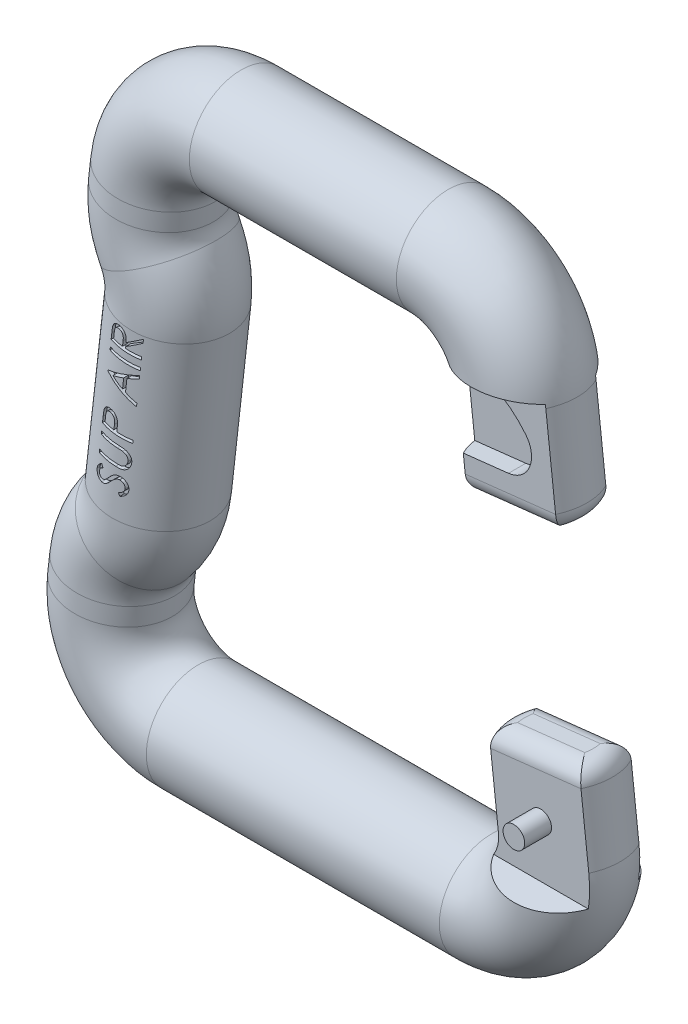
from build123d import *

# Parameters (mm, degrees)
SKETCH2_R           = 5.999999999999999
CUT_EXTRUDE1_DEPTH  = 50.23731898282209
CUT_EXTRUDE3_DEPTH  = 2
FILLET1_R           = 2
FILLET2_R           = 2
CUT_EXTRUDE4_DEPTH  = 2
SKETCH4_R           = 1.2500000000000013
BOSS_EXTRUDE1_DEPTH = 6


with BuildPart() as part:
    # Sweep1: sweep along a path in Sketch1
    with BuildLine(Plane.XY) as sweep1_path:
        Line((24.74193548387098, -11.000000000000007), (25.86987100796293, -20.99028607052877))
        ThreePointArc((25.86987100796293, -20.99028607052877), (23.63815178243092, -27.99635616999022), (16.926690489789717, -31))
        Line((16.926690489789717, -31), (-16.926690489789703, -31.000000000000007))
        ThreePointArc((-16.926690489789703, -31.000000000000007), (-23.638151782430896, -27.996356169990243), (-25.869871007962928, -20.990286070528818))
        Line((-25.869871007962928, -20.990286070528818), (-25.623052047425528, -18.804175277197604))
        ThreePointArc((-25.623052047425528, -18.804175277197604), (-24.95083568241742, -16.265487879724628), (-23.574381586121483, -14.028931896910187))
        ThreePointArc((-23.574381586121483, -14.028931896910187), (-22.197927489825645, -11.792375914095743), (-21.525711124817438, -9.253688516622807))
        Line((-21.525711124817438, -9.253688516622807), (-19.28190239265934, 10.620045968206439))
        ThreePointArc((-19.28190239265934, 10.620045968206439), (-19.371160148682797, 13.244706250312062), (-20.21429210407966, 15.731860658317679))
        ThreePointArc((-20.21429210407966, 15.731860658317679), (-21.057424059476503, 18.219015066323312), (-21.146681815499974, 20.843675348428935))
        Line((-21.146681815499974, 20.843675348428935), (-20.90212907247907, 23.00971392947115))
        ThreePointArc((-20.90212907247907, 23.00971392947115), (-17.955304724296138, 28.711461292641133), (-11.958948554305916, 30.999999999999996))
        Line((-11.958948554305916, 30.999999999999996), (11.95894855430585, 30.999999999999996))
        ThreePointArc((11.95894855430585, 30.999999999999996), (17.955304724296127, 28.711461292641133), (20.90212907247907, 23.009713929471104))
        Line((20.90212907247907, 23.009713929471104), (22.258064516129046, 10.999999999999993))
    # Sketch2 → Sweep1 (sweep)
    with BuildSketch(Plane(origin=(24.74193548387098, -11.000000000000007, 0), x_dir=(0.9936867242414619, 0.11219043660790769, 0), z_dir=(-0.11219043660790769, 0.9936867242414619, 0))):
        Circle(SKETCH2_R)
    sweep(path=sweep1_path.line)

    # Sketch3 → Cut-Extrude1 (cut, through all)
    with BuildSketch(Plane(origin=(0, 0, 0), x_dir=(0, 0, -1), z_dir=(1, 0, 0))):
        Polygon((-5.999999999999998, 24.54661364019623), (-2.900000000000003, 24), (-2.899999999999997, -24), (-5.999999999999998, -24.54661364019623), align=None)
    cut_extrude1 = extrude(amount=CUT_EXTRUDE1_DEPTH, mode=Mode.SUBTRACT)

    # Mirror1: Cut-Extrude1 across plane
    add(cut_extrude1.mirror(Plane.XY), mode=Mode.SUBTRACT)

    # Sketch5 → Cut-Extrude3 (cut)
    with BuildSketch(Plane.XY.offset(2.9)):
        with BuildLine():
            Line((15.127997133283031, 24), (13.078337913522242, 24))
            Line((13.078337913522242, 24), (13.078337913522244, 13.98899280030121))
            Line((13.078337913522244, 13.98899280030121), (21.80930276969724, 14.97474689696582))
            ThreePointArc((21.80930276969724, 14.97474689696582), (24.24615374409276, 16.81207247049478), (23.812818367255925, 19.83303728090512))
            ThreePointArc((23.812818367255925, 19.83303728090512), (19.94436760720821, 22.90435004358217), (15.127997133283031, 24))
        make_face()
    cut_extrude3 = extrude(amount=-CUT_EXTRUDE3_DEPTH, mode=Mode.SUBTRACT)

    # Mirror2: Cut-Extrude3 across plane
    add(cut_extrude3.mirror(Plane.XY), mode=Mode.SUBTRACT)

    # Fillet1
    # the kernel refuses this fillet: 2 mm, written as the material it takes off along each edge
    with BuildSketch(Plane(origin=(22.258064516129036, 10.999999999999991, 0), x_dir=(0.22931075793279015, 0.02588992428273506, 0.9730088838838644), z_dir=(-0.9668660104843982, -0.10916229150630274, 0.2307676577925868))) as fillet1_piece_1:
        with BuildLine():
            CenterArc((6.000000000000002 - FILLET1_R, FILLET1_R), FILLET1_R, 270, 90)
            Line((6.000000000000002 - FILLET1_R, -1.74e-15), (6.000000000000002, -1.75e-15))
            Line((6.000000000000002, -1.75e-15), (6.000000000000003, FILLET1_R))
        make_face()
    revolve(axis=Axis((22.258064516129036, 10.999999999999991, 0), (-0.11219043660790684, 0.993686724241462, 0)), revolution_arc=153.31545765580788, mode=Mode.SUBTRACT)
    with BuildSketch(Plane(origin=(32.445955303624004, 12.150245734072005, 2.9000000000000017), x_dir=(-0.11219043660790687, 0.993686724241462, 0), z_dir=(-0.993686724241462, -0.11219043660790687, 0))) as fillet1_piece_2:
        with BuildLine():
            CenterArc((FILLET1_R, FILLET1_R), FILLET1_R, 180, 90)
            Line((0, FILLET1_R), (0, 0))
            Line((0, 0), (FILLET1_R, 0))
        make_face()
    extrude(amount=20.50523678933512, mode=Mode.SUBTRACT)
    with BuildSketch(Plane(origin=(22.258064516129036, 10.999999999999991, 0), x_dir=(-0.22931075793279074, -0.02588992428273506, -0.9730088838838643), z_dir=(0.9668660104843981, 0.10916229150630273, -0.23076765779258737))) as fillet1_piece_3:
        with BuildLine():
            CenterArc((6.000000000000002 - FILLET1_R, FILLET1_R), FILLET1_R, 270, 90)
            Line((6.000000000000002 - FILLET1_R, 1.89e-15), (6.000000000000002, 7.04e-15))
            Line((6.000000000000002, 7.04e-15), (6.000000000000001, FILLET1_R))
        make_face()
    revolve(axis=Axis((22.258064516129036, 10.999999999999991, 0), (-0.11219043660790684, 0.993686724241462, 0)), revolution_arc=153.31545765580788, mode=Mode.SUBTRACT)
    with BuildSketch(Plane(origin=(32.445955303624004, 12.150245734072005, -2.9000000000000017), x_dir=(-0.11219043660790687, 0.993686724241462, 0), z_dir=(-0.993686724241462, -0.11219043660790687, 0))) as fillet1_piece_4:
        with BuildLine():
            CenterArc((FILLET1_R, -FILLET1_R), FILLET1_R, 90, 90)
            Line((0, -FILLET1_R), (0, 0))
            Line((0, 0), (FILLET1_R, 0))
        make_face()
    extrude(amount=20.50523678933512, mode=Mode.SUBTRACT)

    # Fillet2
    fillet2_edges = [part.edges().sort_by_distance(p)[0] for p in [
        (30.70405582931975, -10.326857380352564, -2.22e-15),
        (24.74193548387098, -11.000000000000007, 2.8999999999999986),
        (18.779815138422208, -11.67314261964745, 0),
        (24.74193548387098, -11.000000000000007, -2.8999999999999986),
    ]]
    fillet(fillet2_edges, radius=FILLET2_R)

    # Sketch6 → Cut-Extrude4 (cut)
    # profile 1 of 6: a face of its own
    with BuildSketch(Plane.XY.offset(5.4)):
        with BuildLine():
            Line((-21.22526216538908, 8.299780960520144), (-21.148138767953185, 8.986880319494503))
            add(Edge.make_bspline(
                [(-21.148138767953185, 8.986880319494503), (-21.142839437375905, 9.032695634793358), (-21.132667241244796, 9.120639265829892), (-21.116866332200168, 9.246694890789366), (-21.099936640113985, 9.360949642628626), (-21.083152302744764, 9.46356599890711), (-21.06658311138429, 9.55455887813084), (-21.049715244450358, 9.633794267895349), (-21.03367222711162, 9.701470363421503), (-21.020312918258497, 9.741825900689525), (-21.01422450513267, 9.760217659238092)],
                knots=[0, 0, 0, 0, 1.4082753462719975, 2.703219363274542, 3.878946779330745, 4.9348021713206265, 5.878173646674772, 6.7025414307882905, 7.4086921808716, 8, 8, 8, 8], degree=3))
            add(Edge.make_bspline(
                [(-21.01422450513267, 9.760217659238092), (-21.004997336875274, 9.78467011580734), (-20.986799069457152, 9.832896433054856), (-20.953651628540246, 9.901913180221472), (-20.91575468037188, 9.966706009392654), (-20.87280767946197, 10.027030755593605), (-20.825711439156933, 10.083318461106037), (-20.774310934955984, 10.13558869252851), (-20.717965331991152, 10.18340543694039), (-20.65709998156238, 10.226598140005887), (-20.592859752786538, 10.265255399302289), (-20.525577138081772, 10.297683995089784), (-20.45519029562011, 10.322874256641192), (-20.382622966184375, 10.34284386881235), (-20.306907665920075, 10.354969362746209), (-20.22914636645212, 10.362383206652405), (-20.148417303044397, 10.362230263848703), (-20.09409206083215, 10.357293705592717), (-20.066307838466003, 10.354768941289375)],
                knots=[0, 0, 0, 0, 1.0322887001872207, 2.0359296909605744, 3.021004968115988, 3.994630807669797, 4.958220814565339, 5.9180869595093855, 6.887631780398401, 7.874134296207386, 8.863915958183112, 9.846911552630642, 10.819661198846822, 11.81421271346405, 12.816153048960262, 13.845298051303622, 14.89799445639931, 16, 16, 16, 16], degree=3))
            add(Edge.make_bspline(
                [(-20.066307838466003, 10.354768941289375), (-20.020983808090005, 10.347932558280364), (-19.932350818060243, 10.33456373247095), (-19.80551719681369, 10.296128438715908), (-19.69016500336988, 10.239582174356288), (-19.584830643560792, 10.169485396780466), (-19.492222646829394, 10.084698849996515), (-19.413610241287586, 9.98609266095731), (-19.350533047690494, 9.87459696563993), (-19.310781412434384, 9.77199247210461), (-19.287039698755756, 9.683152169005224), (-19.271981318753568, 9.610422435391367), (-19.263028934081817, 9.531796921707242), (-19.255313924655034, 9.448139753160692), (-19.25399203705758, 9.35846988614241), (-19.25514646541146, 9.263523832116041), (-19.260826321061533, 9.162937280395028), (-19.267700461210275, 9.094362693145571), (-19.27123572308139, 9.059095864366297)],
                knots=[0, 0, 0, 0, 1.2721769432025023, 2.4877939006647645, 3.6636569702811053, 4.8285560842238775, 5.990992636275886, 7.136613279875263, 8.317019071318532, 9.53580388968788, 10.181451710189275, 10.870207033566075, 11.596486492895929, 12.378182037436407, 13.202848799946214, 14.085805689609556, 15.015560053621257, 15.999999999999998, 15.999999999999998, 15.999999999999998, 15.999999999999998], degree=3))
            Line((-19.27123572308139, 9.059095864366297), (-17.528948062824977, 10.119893140007322))
            Line((-17.528948062824977, 10.119893140007322), (-17.576624344876258, 9.692909966930399))
            Line((-17.576624344876258, 9.692909966930399), (-19.31891200513267, 8.634917178468863))
            Line((-19.31891200513267, 8.634917178468863), (-19.341347902568568, 8.437901954109888))
            Line((-19.341347902568568, 8.437901954109888), (-17.737882357696773, 8.25841477462271))
            Line((-17.737882357696773, 8.25841477462271), (-17.77644405641472, 7.913462851545785))
            Line((-17.77644405641472, 7.913462851545785), (-21.22526216538908, 8.299780960520144))
        make_face()
        with BuildLine():
            Line((-20.848759761542926, 8.60687230667399), (-19.676484120517284, 8.475762531032963))
            Line((-19.676484120517284, 8.475762531032963), (-19.605670819235232, 9.06821044769963))
            add(Edge.make_bspline(
                [(-19.605670819235232, 9.06821044769963), (-19.602708810591565, 9.09600600417584), (-19.59699073098247, 9.149664593272018), (-19.591250126351465, 9.227763551134046), (-19.588739415280845, 9.300488466327279), (-19.587318346326057, 9.367856077205186), (-19.59058671306946, 9.42982825812198), (-19.59505225722329, 9.486504276218675), (-19.602590189362406, 9.53786232948604), (-19.61664447626103, 9.59832303561509), (-19.64017250546451, 9.667671807439158), (-19.680912037187436, 9.742861502760794), (-19.731664125007356, 9.810613353123522), (-19.793900798750318, 9.868230516557748), (-19.862969706864675, 9.917575702085912), (-19.93889385296121, 9.955660542075968), (-20.020353921951955, 9.983082189703985), (-20.07733636423299, 9.991513302724561), (-20.106271780773696, 9.995794582315016)],
                knots=[0, 0, 0, 0, 1.116804667455485, 2.155961971942709, 3.1277859603184335, 4.024240112258224, 4.846793603243793, 5.605954830140939, 6.295291751765251, 6.918184528589704, 8.084631972486369, 9.208441058437982, 10.32149201286966, 11.451027748790125, 12.583184936360725, 13.702329280963324, 14.833253601156654, 16, 16, 16, 16], degree=3))
            add(Edge.make_bspline(
                [(-20.106271780773696, 9.995794582315016), (-20.134780038695308, 9.99781327016558), (-20.19098082450644, 10.001792883505024), (-20.27500034033198, 9.99293145023248), (-20.35600944588299, 9.971771597652452), (-20.433176485813554, 9.93870048626049), (-20.50398899996697, 9.895468568787589), (-20.567777387154837, 9.844200855764223), (-20.620560562113507, 9.782558611085065), (-20.65798447205481, 9.724999175753446), (-20.683389801338866, 9.6724714682596), (-20.700297021898265, 9.625986540770887), (-20.717578669471667, 9.573592774722783), (-20.731467251563007, 9.514001622276536), (-20.74687078472378, 9.448595477644771), (-20.75871047263346, 9.376098869723588), (-20.771099631210436, 9.297427890250864), (-20.777447521304467, 9.242584265993425), (-20.780750947440364, 9.214043781032965)],
                knots=[0, 0, 0, 0, 1.1632796948630364, 2.2932735191746967, 3.4255542548063835, 4.565185983436548, 5.702385963412157, 6.79903542384222, 7.8861668733804855, 8.996102559097864, 9.588392885088506, 10.26077810904959, 11.011001767887944, 11.835906216229654, 12.753527901846914, 13.749688968881866, 14.828943764939497, 15.999999999999998, 15.999999999999998, 15.999999999999998, 15.999999999999998], degree=3))
            Line((-20.780750947440364, 9.214043781032965), (-20.848759761542926, 8.60687230667399))
        make_face(mode=Mode.SUBTRACT)
    # profile 2 of 6: a face of its own
    with BuildSketch(Plane.XY.offset(5.4)):
        Polygon((-21.353794975325798, 7.16164798184985), (-21.315233276607852, 7.506599904926773), (-17.86641516763349, 7.1202817959524145), (-17.904976866351436, 6.77532987287549), align=None)
    # profile 3 of 6: a face of its own
    with BuildSketch(Plane.XY.offset(5.4)):
        Polygon((-21.593168497764445, 5.052900766624087), (-17.963460965713164, 6.274956055085625), (-18.005528273405467, 5.904763747393318), (-19.200239811867007, 5.489699644829215), (-19.367106799046493, 4.0033214397010095), (-18.292988209302905, 3.3372557345728047), (-18.336457760584956, 2.9530409909830615), (-21.602283081097777, 4.968766151239472), align=None)
        Polygon((-20.865404074687522, 4.92880220893178), (-19.6826116067388, 4.196129933290753), (-19.550800709302905, 5.375416792265112), align=None, mode=Mode.SUBTRACT)
    # profile 4 of 6: a face of its own
    with BuildSketch(Plane.XY.offset(5.4)):
        with BuildLine():
            Line((-22.224134409867027, -0.5497770510097729), (-22.147011012431125, 0.13732230796458617))
            add(Edge.make_bspline(
                [(-22.147011012431125, 0.13732230796458617), (-22.141508700880745, 0.18454410591075635), (-22.13096040618169, 0.275071411824813), (-22.11416374801412, 0.4045599034531211), (-22.09751054342439, 0.52195472252342), (-22.080338383490083, 0.6269910113556525), (-22.06170884201567, 0.7196364267623955), (-22.044629289905423, 0.8004832208956563), (-22.027102555771865, 0.869299884190706), (-22.012651644521544, 0.9102721139929228), (-22.006085531661896, 0.9288888143748424)],
                knots=[0, 0, 0, 0, 1.4165767783512053, 2.715671256539882, 3.8905700806194283, 4.949545173868573, 5.886425593501877, 6.705964850652123, 7.412024564555704, 8, 8, 8, 8], degree=3))
            add(Edge.make_bspline(
                [(-22.006085531661896, 0.9288888143748424), (-21.996833017006566, 0.9521675796508015), (-21.97850576904686, 0.9982778231144697), (-21.945409328774698, 1.064516808970198), (-21.90745871090974, 1.1265802662340811), (-21.86612706788889, 1.1854119012790822), (-21.819654405085757, 1.2396615893176666), (-21.768107198753324, 1.2891282005011917), (-21.713219552560766, 1.3360279326451998), (-21.65383597164073, 1.3783522549382043), (-21.591094432669045, 1.4168054582685161), (-21.523882532040705, 1.447132425638073), (-21.454538567158814, 1.4730162069466741), (-21.381731076346327, 1.4907511602600858), (-21.306555483007866, 1.5036137631681623), (-21.228199198085704, 1.5099966299273366), (-21.146832986655106, 1.509006459484795), (-21.091799189951956, 1.5041685969806826), (-21.063777839354202, 1.5017053207850988)],
                knots=[0, 0, 0, 0, 1.0051594586673875, 1.9910053995358428, 2.9675244703069343, 3.9227712245342, 4.874094977569468, 5.8293417317967675, 6.787807136433937, 7.769224900013368, 8.753775760606036, 9.73586574355943, 10.724029646975051, 11.720528892482337, 12.73834604283004, 13.782999043351941, 14.871177988738769, 16, 16, 16, 16], degree=3))
            add(Edge.make_bspline(
                [(-21.063777839354202, 1.5017053207850988), (-21.03566044804812, 1.4979185824190397), (-20.98072561981454, 1.4905201783693742), (-20.900914741140184, 1.4725118183316366), (-20.8251952971937, 1.4505866826024034), (-20.75404822829092, 1.422457935990305), (-20.68763806159095, 1.3885957065515409), (-20.62583954658505, 1.349142962945414), (-20.56813655531266, 1.3048041962459183), (-20.51458775728983, 1.2557782556950186), (-20.46654430641544, 1.201583098561871), (-20.422516185610093, 1.1440863668955454), (-20.384869151611614, 1.081979624720846), (-20.35177914312775, 1.0165963533265758), (-20.32354782743739, 0.947451459181757), (-20.300571445040802, 0.8742613845765115), (-20.281987439065432, 0.7972393245028695), (-20.27457150698013, 0.7441065484755667), (-20.270809089354202, 0.7171500323235607)],
                knots=[0, 0, 0, 0, 1.1203220365173474, 2.18884810373767, 3.2288318675058454, 4.231805184716641, 5.206284375570954, 6.169324588133576, 7.124052803457623, 8.078021791452562, 9.032616069361207, 9.981747546100836, 10.935001414813907, 11.897067472698165, 12.874341876725532, 13.881725007413635, 14.92530904045551, 16, 16, 16, 16], degree=3))
            add(Edge.make_bspline(
                [(-20.270809089354202, 0.7171500323235607), (-20.268713549059083, 0.6949627165371062), (-20.264154620975052, 0.6466933621926676), (-20.261949260792754, 0.5675921798338753), (-20.26184533596646, 0.4761702302358449), (-20.265688579900846, 0.37189561065398086), (-20.272712215890174, 0.2552465307039557), (-20.28359885376443, 0.1260357382040543), (-20.29685226109272, -0.01560532447783474), (-20.30738347899166, -0.11415851120729845), (-20.312876397046512, -0.16556230742002928)],
                knots=[0, 0, 0, 0, 0.6041145931229165, 1.3142744097913275, 2.1443785323552222, 3.082741129999513, 4.142860979208862, 5.312676663059557, 6.598334302989068, 8, 8, 8, 8], degree=3))
            Line((-20.312876397046512, -0.16556230742002928), (-20.340220147046512, -0.41165605742002925))
            Line((-20.340220147046512, -0.41165605742002925), (-18.736754602174717, -0.5911432369072088))
            Line((-18.736754602174717, -0.5911432369072088), (-18.775316300892666, -0.936095159984132))
            Line((-18.775316300892666, -0.936095159984132), (-22.224134409867027, -0.5497770510097729))
        make_face()
        with BuildLine():
            Line((-21.850436493200355, -0.24198458306105494), (-20.678160852174717, -0.37379548049695244))
            Line((-20.678160852174717, -0.37379548049695244), (-20.60594530730292, 0.20883673104150924))
            add(Edge.make_bspline(
                [(-20.60594530730292, 0.20883673104150924), (-20.603067534883458, 0.23734040962931302), (-20.597505284059014, 0.29243323373601704), (-20.590641958617045, 0.3723298125592024), (-20.588271816876482, 0.44673242488093257), (-20.587182650554887, 0.5152350311998969), (-20.58915484815389, 0.578195110646081), (-20.59420624479361, 0.6352406502468766), (-20.60055857256781, 0.6869590154155945), (-20.614806766370336, 0.747163707528242), (-20.63866623536354, 0.8159591829592266), (-20.678198625729983, 0.891443058768465), (-20.729428620620926, 0.9588969816499734), (-20.79107116437421, 1.0173715064721023), (-20.86067037715491, 1.0664307957261119), (-20.936151011232294, 1.1055769647338747), (-21.017852990086016, 1.1327685731389898), (-21.07481615438827, 1.1412358205341058), (-21.103741781661896, 1.1455354489902274)],
                knots=[0, 0, 0, 0, 1.1369878110965272, 2.1976065052533205, 3.1814365416748482, 4.090415647221283, 4.916342924350731, 5.679643787580509, 6.363028306959409, 6.981735579918175, 8.131588121449868, 9.243483230792846, 10.349055082486776, 11.477384921729541, 12.60193462296951, 13.717768390284233, 14.841093508351483, 16, 16, 16, 16], degree=3))
            add(Edge.make_bspline(
                [(-21.103741781661896, 1.1455354489902274), (-21.132255586084355, 1.1475773560330378), (-21.18846730619062, 1.151602743367289), (-21.272574974674537, 1.1423868535134991), (-21.354465885919932, 1.1223256476374288), (-21.43268269174648, 1.089086137651306), (-21.504807396282473, 1.0461170709873175), (-21.569644173542653, 0.9946218330770613), (-21.62268923624022, 0.9325369314120868), (-21.660654341172794, 0.8746483771883674), (-21.685595166648447, 0.8216601857283193), (-21.70258283029876, 0.7752342509420415), (-21.72003037764546, 0.7231289554166562), (-21.734000494060734, 0.6640565008958506), (-21.74804278492816, 0.5988492122574686), (-21.761655655606152, 0.5274180496606043), (-21.77237563620919, 0.4494103865538693), (-21.778993834325007, 0.3953430397659561), (-21.782427679097793, 0.36729025668253495)],
                knots=[0, 0, 0, 0, 1.1623833135475303, 2.2915064054332555, 3.4297823766858833, 4.586068412239483, 5.738704186598868, 6.841885626052547, 7.941611387232348, 9.05069179660089, 9.651115043766858, 10.322982151960717, 11.063566568227671, 11.887835374996813, 12.79341241651033, 13.781128502078108, 14.848740977334153, 16, 16, 16, 16], degree=3))
            Line((-21.782427679097793, 0.36729025668253495), (-21.850436493200355, -0.24198458306105494))
        make_face(mode=Mode.SUBTRACT)
    # profile 5 of 6: a face of its own
    with BuildSketch(Plane.XY.offset(5.4)):
        with BuildLine():
            Line((-22.58015939059863, -3.701538601958534), (-22.541597691880682, -3.3565866788816106))
            Line((-22.541597691880682, -3.3565866788816106), (-20.459265961111452, -3.5900602365739185))
            add(Edge.make_bspline(
                [(-20.459265961111452, -3.5900602365739185), (-20.429831244941976, -3.593450434406288), (-20.374036168036106, -3.599876735502384), (-20.294486141612765, -3.6072034456161157), (-20.22371500238023, -3.614371697565665), (-20.161587912988253, -3.620373081649934), (-20.10799736429661, -3.6233392343411226), (-20.063176570911956, -3.6268430470475335), (-20.026908023712828, -3.6272808312801796), (-20.00563963660654, -3.6272380322191187), (-19.99652557649607, -3.6272196917021238)],
                knots=[0, 0, 0, 0, 1.5309628144647474, 2.9020217990641752, 4.127679995824138, 5.206793532866248, 6.12656749953364, 6.900951253817214, 7.529028868668444, 8, 8, 8, 8], degree=3))
            add(Edge.make_bspline(
                [(-19.99652557649607, -3.6272196917021238), (-19.963273899591645, -3.6258289764417846), (-19.89874859912785, -3.623130275853212), (-19.805859958852302, -3.6074770465565846), (-19.72008675880352, -3.5833755704888612), (-19.641289305523856, -3.548151724398353), (-19.56742505036213, -3.5022386155007346), (-19.50020298961454, -3.441040927295202), (-19.435903757483956, -3.368400709127424), (-19.377738128218894, -3.2838146842603106), (-19.326491578425518, -3.192467834116856), (-19.286245628473058, -3.0972651280776855), (-19.257414909947993, -3.000570746919455), (-19.24766568719079, -2.9349017859792923), (-19.242819647008886, -2.9022597558046876)],
                knots=[0, 0, 0, 0, 1.0403779717065162, 2.0188666398159834, 2.939880111275459, 3.8203839098019503, 4.710940239829494, 5.648494415179196, 6.653453166769341, 7.740671601037499, 8.853551786202107, 9.925043290625831, 10.96860253994111, 12, 12, 12, 12], degree=3))
            add(Edge.make_bspline(
                [(-19.242819647008886, -2.9022597558046876), (-19.2405613636131, -2.8740013798398416), (-19.236045796283143, -2.81749713438386), (-19.24046331010101, -2.73249587348956), (-19.254798059518137, -2.648413288603823), (-19.277838609482284, -2.5659144654577792), (-19.30937779001453, -2.4866762798691013), (-19.347410464968544, -2.4112311807150215), (-19.396263651834552, -2.3433293750207547), (-19.450633871193688, -2.279593444486646), (-19.513601191604483, -2.2227937637649857), (-19.583558808823632, -2.1719507083215017), (-19.66108438089075, -2.1273355190939416), (-19.716965106896552, -2.1037941884890796), (-19.745523973931963, -2.091762960932893)],
                knots=[0, 0, 0, 0, 0.9913586576189385, 1.982278563874224, 2.9692748231959567, 3.9714730917003025, 4.97393834609509, 5.950714156133253, 6.9196503264343345, 7.8937855945808675, 8.878100762231629, 9.879364019486232, 10.916210197560797, 12, 12, 12, 12], degree=3))
            add(Edge.make_bspline(
                [(-19.745523973931963, -2.091762960932893), (-19.75763126121018, -2.0874180329353553), (-19.78436638327614, -2.077823631009254), (-19.829548584779758, -2.065336418859393), (-19.883493260505695, -2.0538525603732443), (-19.945911672149123, -2.041944624587025), (-20.01698050372636, -2.030054834256271), (-20.096936593004674, -2.0182631509288425), (-20.18571064067995, -2.0062057049023205), (-20.247977607740992, -1.9993091560225724), (-20.280479903419142, -1.9957092750354566)],
                knots=[0, 0, 0, 0, 0.566776084729653, 1.2515460698266585, 2.063738505205296, 2.9970038942381603, 4.05192826499323, 5.23910222148392, 6.558858409684378, 8, 8, 8, 8], degree=3))
            Line((-20.280479903419142, -1.9957092750354566), (-22.362811634188375, -1.7622357173431493))
            Line((-22.362811634188375, -1.7622357173431493), (-22.324249935470423, -1.4179849160610978))
            Line((-22.324249935470423, -1.4179849160610978), (-20.241918204701193, -1.6514584737534057))
            add(Edge.make_bspline(
                [(-20.241918204701193, -1.6514584737534057), (-20.204498820925906, -1.655931665249119), (-20.13140399332426, -1.6646695740070987), (-20.024791051362996, -1.6808359135867923), (-19.923795554888123, -1.699075885071107), (-19.828440984046296, -1.7189236867097868), (-19.73954884008289, -1.742453795390077), (-19.65605115430178, -1.7667082451462606), (-19.578624476553703, -1.7939638867180208), (-19.506147770304455, -1.823570948624649), (-19.437864267948015, -1.8566655921938024), (-19.373234502801964, -1.8952069205142335), (-19.311916789477102, -1.940003400476012), (-19.25315069268832, -1.9894877856352602), (-19.197486426248133, -2.044682548575745), (-19.14468210425238, -2.104907658537581), (-19.095979963215886, -2.171435897302611), (-19.048936550649355, -2.2415172287739624), (-19.006707151142926, -2.3158659251591502), (-18.972666891430368, -2.3943861609334802), (-18.943971952348797, -2.474992323618041), (-18.924226961920827, -2.559020378388503), (-18.909551745985777, -2.645397816722291), (-18.904056184785688, -2.7348201783557), (-18.90323640421998, -2.8269605644301605), (-18.90943848183098, -2.888967805180812), (-18.912591281624273, -2.920488922471354)],
                knots=[0, 0, 0, 0, 1.2967658679279042, 2.533095630999796, 3.7098979467260054, 4.828226582658274, 5.883503038414783, 6.873347322964681, 7.819528533368582, 8.706652878199817, 9.566265930858833, 10.428283290082634, 11.29213692355788, 12.176669306779232, 13.069498456437014, 13.987190711434414, 14.929742101056382, 15.90447538235228, 16.89104722907586, 17.866841589234088, 18.846043490372153, 19.83107353573146, 20.83325563670343, 21.85717652870428, 22.91070479585999, 24, 24, 24, 24], degree=3))
            add(Edge.make_bspline(
                [(-18.912591281624273, -2.920488922471354), (-18.917064364159266, -2.954678206022732), (-18.92584344853316, -3.0217797188234963), (-18.94624197176536, -3.1197809419782945), (-18.973070662042616, -3.2128388147560236), (-19.00461343642457, -3.302046980658539), (-19.04217129667902, -3.38692341655517), (-19.086958522664233, -3.4667801910428433), (-19.135606285714054, -3.54320386335539), (-19.19145499454659, -3.6134961070895586), (-19.250396259026132, -3.6794067825191132), (-19.31372617196252, -3.7385679162086234), (-19.380728725224134, -3.7907027470156582), (-19.450951697315308, -3.836275475515198), (-19.52426339558557, -3.8758705825692386), (-19.600887281797917, -3.9089311519460677), (-19.681117351821776, -3.93529715801173), (-19.736509603864455, -3.9467582401632426), (-19.764454262393503, -3.9525402045226365)],
                knots=[0, 0, 0, 0, 1.151508229486181, 2.2600047785423487, 3.339843946014751, 4.384338515858936, 5.418748478736872, 6.435569397388422, 7.440301204627874, 8.441326062389146, 9.43068488572108, 10.391765546968239, 11.331849233806995, 12.262943554749327, 13.18506001402019, 14.11172560437248, 15.047390542014899, 16, 16, 16, 16], degree=3))
            add(Edge.make_bspline(
                [(-19.764454262393503, -3.9525402045226365), (-19.783352966181855, -3.955600099400351), (-19.824485107530656, -3.9622598169149574), (-19.891514748116908, -3.9671445121977795), (-19.96844949619809, -3.9700822448444293), (-20.055238574625392, -3.969160446532946), (-20.151973552689284, -3.9643906713692214), (-20.258616197532525, -3.958476238527412), (-20.375027650162, -3.948484333974569), (-20.45577837676043, -3.939625312965953), (-20.4978276598294, -3.935012159650842)],
                knots=[0, 0, 0, 0, 0.6243066069215494, 1.3587740137351718, 2.1903793562298053, 3.135820171427915, 4.188964092085398, 5.34988354910652, 6.620006264915658, 8, 8, 8, 8], degree=3))
            Line((-20.4978276598294, -3.935012159650842), (-22.58015939059863, -3.701538601958534))
        make_face()
    # profile 6 of 6: a face of its own
    with BuildSketch(Plane.XY.offset(5.4)):
        with BuildLine():
            Line((-20.08678108955881, -6.791509478646178), (-20.229809935712655, -6.478809158133358))
            add(Edge.make_bspline(
                [(-20.229809935712655, -6.478809158133358), (-20.181964608804048, -6.458383439629535), (-20.090125933605282, -6.419176456448977), (-19.964764225278927, -6.349586072788355), (-19.85575598587952, -6.276286929215532), (-19.76555133293599, -6.196443936224608), (-19.690602596263933, -6.112997379199675), (-19.63564534607771, -6.022438633711802), (-19.59555842823656, -5.927541224927696), (-19.585090803019018, -5.860769622286317), (-19.579870031866502, -5.82746701069746)],
                knots=[0, 0, 0, 0, 1.290925625361476, 2.4779201412878296, 3.554723080839919, 4.54551879932194, 5.462610222408984, 6.327470803613783, 7.165819180686342, 8, 8, 8, 8], degree=3))
            add(Edge.make_bspline(
                [(-19.579870031866502, -5.82746701069746), (-19.577407007304444, -5.798732224722194), (-19.57251823924846, -5.741697590989605), (-19.57980704267256, -5.656425261751572), (-19.59568229053267, -5.572780434364254), (-19.622434070762548, -5.492136624017914), (-19.657467893939984, -5.415871342805321), (-19.702322058386688, -5.347325850133576), (-19.75407563071093, -5.286291743582237), (-19.814369544826334, -5.235276926105592), (-19.879123008616332, -5.192593748682079), (-19.947877507100472, -5.15920855692969), (-20.01982906724922, -5.135446940534539), (-20.069567970144377, -5.127982483961609), (-20.0944934293024, -5.1242418504410505)],
                knots=[0, 0, 0, 0, 1.0695709813557621, 2.122952620045213, 3.166666210637488, 4.226396802343181, 5.271156975869077, 6.275305450991947, 7.260280780233762, 8.233013219960455, 9.19859083083084, 10.134358472279239, 11.06507845979757, 12, 12, 12, 12], degree=3))
            add(Edge.make_bspline(
                [(-20.0944934293024, -5.1242418504410505), (-20.123492195078768, -5.12259285472382), (-20.1822157387588, -5.119253579087893), (-20.27141828116516, -5.131945240593908), (-20.361210854463117, -5.159775417600256), (-20.41831668976618, -5.188571669133503), (-20.447858813917783, -5.203468613261563)],
                knots=[0, 0, 0, 0, 0.9460467536096231, 1.915778702009981, 2.921785768164213, 4, 4, 4, 4], degree=3))
            add(Edge.make_bspline(
                [(-20.447858813917783, -5.203468613261563), (-20.46926829366678, -5.215857372914401), (-20.514302507005674, -5.2419167658445955), (-20.58222471750421, -5.287774703513849), (-20.653752619129296, -5.3419347220989835), (-20.72858113727153, -5.404731681638605), (-20.807775580340927, -5.474931691659438), (-20.891332349262427, -5.552678731301434), (-20.978280850838587, -5.639215630570936), (-21.03670685855784, -5.700429099338508), (-21.06694935878958, -5.732114446594896)],
                knots=[0, 0, 0, 0, 0.7264719163358938, 1.5281123898639268, 2.4055191417612494, 3.3610237841103374, 4.396976586613083, 5.514208626024208, 6.7133033876837995, 8, 8, 8, 8], degree=3))
            add(Edge.make_bspline(
                [(-21.06694935878958, -5.732114446594896), (-21.096990713622976, -5.76353522029346), (-21.154327313580353, -5.823504563949788), (-21.23800383421486, -5.9076504807516566), (-21.31415600581656, -5.982731566341084), (-21.383523590233246, -6.0482826478830365), (-21.446718862108913, -6.103892894367981), (-21.50314723014945, -6.149855769859566), (-21.552266400949033, -6.187345969098336), (-21.584002847905346, -6.206981210209221), (-21.5983996793024, -6.2158884850564355)],
                knots=[0, 0, 0, 0, 1.4483144934646788, 2.7642371385970828, 3.953563445864588, 5.011213123113441, 5.943679914383341, 6.757250636168316, 7.436242718521421, 8, 8, 8, 8], degree=3))
            add(Edge.make_bspline(
                [(-21.5983996793024, -6.2158884850564355), (-21.620440496602196, -6.228120645682677), (-21.66379738694038, -6.252182750080047), (-21.731017911243438, -6.282541891791087), (-21.798704432230096, -6.307142676336701), (-21.867251852607, -6.325424168631594), (-21.936176886323253, -6.338084848222507), (-22.005799383252274, -6.345279195067829), (-22.076211359913767, -6.34600722474524), (-22.12309232597069, -6.3420019782687325), (-22.14667692289214, -6.339987042748743)],
                knots=[0, 0, 0, 0, 1.0570478813378734, 2.0793380050296224, 3.0902837036602504, 4.074787628975462, 5.051598276776991, 6.02707976244133, 7.007475048519726, 8, 8, 8, 8], degree=3))
            add(Edge.make_bspline(
                [(-22.14667692289214, -6.339987042748743), (-22.183362819088426, -6.334729772729083), (-22.255519431501796, -6.324389373979345), (-22.35899383475699, -6.290809707231296), (-22.45634580817552, -6.246162619624347), (-22.54638774065274, -6.188253998960974), (-22.627805130160223, -6.119350154350673), (-22.69770164319746, -6.03860646958095), (-22.75803898775962, -5.9493625335541465), (-22.805168967594888, -5.850390056128171), (-22.840109117245213, -5.74554541697587), (-22.86203746668983, -5.636810163934285), (-22.870356287387597, -5.525016950488378), (-22.86422344115255, -5.450241560819616), (-22.861120031866502, -5.412402908133358)],
                knots=[0, 0, 0, 0, 1.0195195273469124, 2.005268591205431, 2.984856399302119, 3.9637666435563137, 4.945827815184059, 5.913275464044463, 6.897382488813531, 7.905448675126987, 8.923645405983335, 9.935243202104756, 10.955169398605177, 11.999999999999998, 11.999999999999998, 11.999999999999998, 11.999999999999998], degree=3))
            add(Edge.make_bspline(
                [(-22.861120031866502, -5.412402908133358), (-22.85520636368332, -5.3724355599302855), (-22.84347455650716, -5.293146494677316), (-22.80662344944876, -5.1789843063690055), (-22.756468117490968, -5.07015990079843), (-22.701879892299978, -4.98474856059005), (-22.649816718114923, -4.918662633287132), (-22.60402852305017, -4.868588951670576), (-22.5509911460166, -4.8193885213008105), (-22.493096173409732, -4.768327711837919), (-22.427468343864234, -4.718937826614977), (-22.355674581546722, -4.66925650864148), (-22.278228952806735, -4.6185129975337995), (-22.223259605075853, -4.586686236538332), (-22.195054326738298, -4.5703556324923325)],
                knots=[0, 0, 0, 0, 1.2970514684495411, 2.5731504125772644, 3.840481864390654, 5.141119206432395, 5.82055133012562, 6.543812626731447, 7.319791446387525, 8.145366721616103, 9.024492068418565, 9.958268770504104, 10.952368911118683, 12, 12, 12, 12], degree=3))
            Line((-22.195054326738298, -4.5703556324923325), (-22.013463781866502, -4.8760447350564355))
            add(Edge.make_bspline(
                [(-22.013463781866502, -4.8760447350564355), (-22.036026678117516, -4.889397346564089), (-22.0795127699376, -4.915132202745672), (-22.140477709449335, -4.955693238359201), (-22.196551485737885, -4.9936535030316564), (-22.2464243017006, -5.031078213943303), (-22.291006970822817, -5.066671796547599), (-22.32942928485279, -5.101768138430686), (-22.362881555654578, -5.135334155739274), (-22.3987790824398, -5.178776145372113), (-22.435478496018124, -5.234521852781042), (-22.469553864648244, -5.305439367789158), (-22.49380657363283, -5.380746514895204), (-22.50168562100596, -5.433051875465038), (-22.505651281866506, -5.459378068389769)],
                knots=[0, 0, 0, 0, 1.1857721267508803, 2.2853713019787083, 3.3117357407766073, 4.248425441987792, 5.105351997793476, 5.891179199578453, 6.601400320824357, 7.247077345093765, 8.437553068758351, 9.610245381049246, 10.797195154457185, 12, 12, 12, 12], degree=3))
            add(Edge.make_bspline(
                [(-22.505651281866506, -5.459378068389769), (-22.508039466772527, -5.492800129619382), (-22.512670010981903, -5.55760345858363), (-22.499310037725124, -5.652448605499283), (-22.467624267455303, -5.738997750791603), (-22.420706343764166, -5.816441901117713), (-22.360025685168747, -5.881382942513271), (-22.288676374287185, -5.931781720655304), (-22.208342534600494, -5.967427648596032), (-22.15028564150186, -5.9768950287130425), (-22.120735416481885, -5.981713805569255)],
                knots=[0, 0, 0, 0, 1.1066019033117374, 2.145633289344594, 3.1413665910926585, 4.137460230597412, 5.122352461010867, 6.060051567470116, 7.012590759704947, 8, 8, 8, 8], degree=3))
            add(Edge.make_bspline(
                [(-22.120735416481885, -5.981713805569255), (-22.102051415260803, -5.983339490956945), (-22.064696503475417, -5.986589722720978), (-22.008258354458622, -5.983231470671183), (-21.95218593467705, -5.974818847862575), (-21.895376553442098, -5.960975151226143), (-21.837565579701202, -5.937342960881706), (-21.776529058916616, -5.905861060702007), (-21.712690837114877, -5.8638615014906925), (-21.670395771122735, -5.831266802705224), (-21.648179326738298, -5.814145696594896)],
                knots=[0, 0, 0, 0, 0.8710998001226096, 1.7415892776292385, 2.6207190609632622, 3.506340432400798, 4.45281541837476, 5.517279974506925, 6.695894897557551, 8, 8, 8, 8], degree=3))
            add(Edge.make_bspline(
                [(-21.648179326738298, -5.814145696594896), (-21.640617708961436, -5.807691658084517), (-21.62261826354613, -5.792328660733424), (-21.593628357519478, -5.762814413110545), (-21.55542186565458, -5.726020918211606), (-21.51004355108933, -5.679757852521205), (-21.45749292214429, -5.623890822915192), (-21.396423942179293, -5.5596737931783915), (-21.328001920930436, -5.486018957014389), (-21.279631248951052, -5.434129861308923), (-21.25414887802035, -5.4067939337743836)],
                knots=[0, 0, 0, 0, 0.4206840100621821, 1.0013834472538132, 1.7499743370007284, 2.6664601424392522, 3.7441876405972554, 4.996936996957928, 6.417942893073656, 8, 8, 8, 8], degree=3))
            add(Edge.make_bspline(
                [(-21.25414887802035, -5.4067939337743836), (-21.22301089321629, -5.373901132585161), (-21.16267362117612, -5.3101634852709125), (-21.072128974718705, -5.220448286829717), (-20.985251785204063, -5.138703755040005), (-20.901431729002987, -5.066067611209523), (-20.820943483273982, -5.001457295528381), (-20.743760486289073, -4.945701442022873), (-20.669760208230237, -4.898023025846513), (-20.576813407487965, -4.847464881108485), (-20.46279571614348, -4.79914651362008), (-20.32655870383134, -4.76046747997883), (-20.191642621057, -4.741888277581546), (-20.103161948754455, -4.747681225264748), (-20.059437339558812, -4.7505439337743836)],
                knots=[0, 0, 0, 0, 1.152256346409815, 2.2327714870065605, 3.2423656436144763, 4.186529870399027, 5.053820472459741, 5.867351207706715, 6.607930112596173, 7.291721620296933, 8.55728095349125, 9.748888731330617, 10.88756540929178, 11.999999999999998, 11.999999999999998, 11.999999999999998, 11.999999999999998], degree=3))
            add(Edge.make_bspline(
                [(-20.059437339558812, -4.7505439337743836), (-20.028708272451635, -4.754831052626219), (-19.968035291368345, -4.763295750890312), (-19.879784893792685, -4.786678477979902), (-19.79587071170156, -4.819377634978266), (-19.71572658790142, -4.85981510052351), (-19.640160165665083, -4.909676272549898), (-19.568435064665834, -4.9672853739064715), (-19.50069819991831, -5.033651778188548), (-19.438477752204943, -5.108174480112089), (-19.38220676146539, -5.187776129974337), (-19.33383205103501, -5.271105244933138), (-19.295237823835723, -5.357641994315754), (-19.265601107285484, -5.447121814317915), (-19.2451810959889, -5.539456048236459), (-19.234084297566003, -5.6347943767483795), (-19.231658183597364, -5.732974278809373), (-19.237547803231884, -5.798983779818278), (-19.240527083148553, -5.832374863261563)],
                knots=[0, 0, 0, 0, 0.9876941111831807, 1.9501518192818836, 2.899944104903564, 3.852154911098089, 4.804045543694862, 5.778350211559423, 6.778589982069233, 7.819477329342305, 8.866655206035098, 9.880543245203684, 10.88360488431568, 11.879429912087534, 12.878283501922844, 13.890338676223344, 14.932822151014355, 15.999999999999998, 15.999999999999998, 15.999999999999998, 15.999999999999998], degree=3))
            add(Edge.make_bspline(
                [(-19.240527083148553, -5.832374863261563), (-19.243816662427225, -5.8581626036212535), (-19.250351460257793, -5.909390330780964), (-19.268023712157735, -5.984318745942162), (-19.288192373398886, -6.057358288319508), (-19.315689794448684, -6.127321466682847), (-19.34688170683577, -6.195209061137583), (-19.383565517966158, -6.260936552296794), (-19.425770205424445, -6.323622066012419), (-19.47222886280443, -6.3848135300156015), (-19.525208951249823, -6.4429741031997505), (-19.584360110984097, -6.499649857172278), (-19.651221583183464, -6.553092990787194), (-19.724413841563205, -6.605566430808668), (-19.805342432569965, -6.654616202035944), (-19.892243768063555, -6.7037060441060135), (-19.987129979359047, -6.748640070713022), (-20.053038450487016, -6.776993564511249), (-20.08678108955881, -6.791509478646178)],
                knots=[0, 0, 0, 0, 0.9229415725782948, 1.833437067572599, 2.7321581721190453, 3.612629035175949, 4.500468309958075, 5.385157208745112, 6.283264432684048, 7.183365237819489, 8.112189035584192, 9.075337525394607, 10.0906832558452, 11.15047970356777, 12.272645391862536, 13.450882356915622, 14.694948386601983, 16, 16, 16, 16], degree=3))
        make_face()
    extrude(amount=CUT_EXTRUDE4_DEPTH, mode=Mode.SUBTRACT)

    # Sketch4 → Boss-Extrude1 (add, symmetric)
    with BuildSketch(Plane.XY):
        with Locations(Location((25.53225806451613, -17.999999999999993, 0), (0, 0, 270))):
            Circle(SKETCH4_R)
    extrude(amount=BOSS_EXTRUDE1_DEPTH, both=True)


solid = part.part
